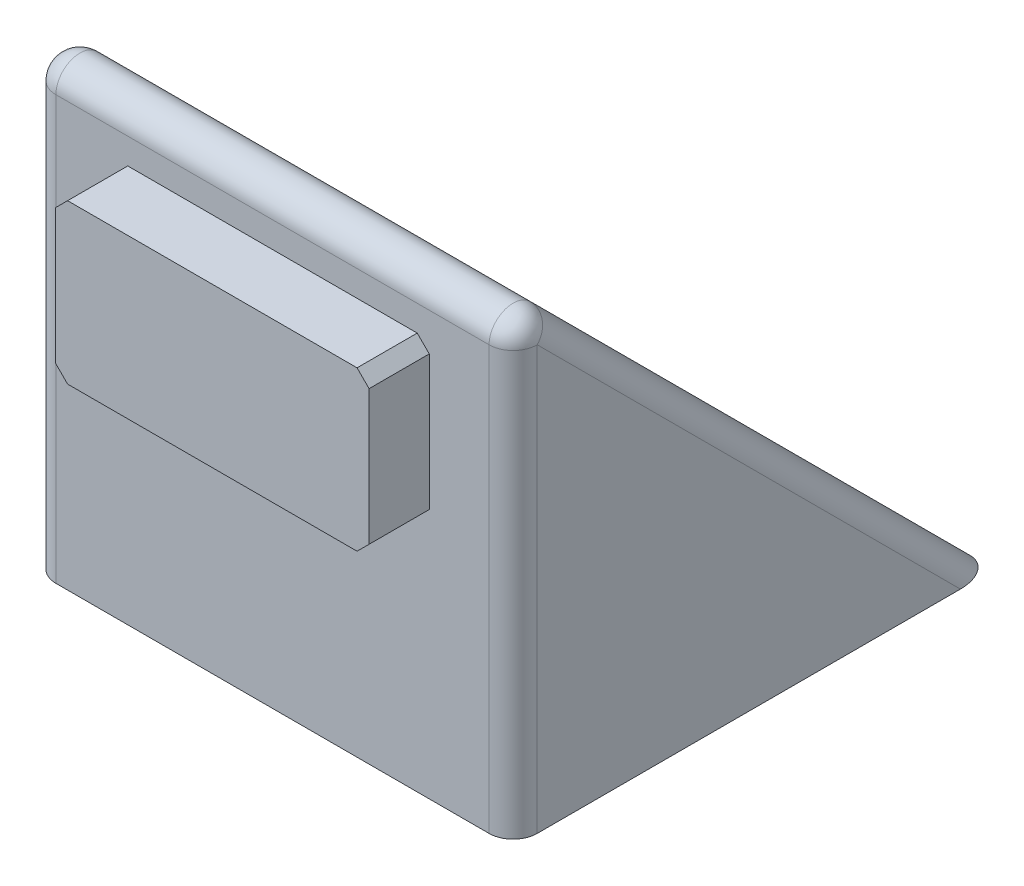
from build123d import *

# Parameters (mm, degrees)
Y_KSEKLIK_EKSTR_ZYON1_DEPTH      = 20
Y_KSEKLIK_EKSTR_ZYON1_DEPTH_BACK = 20
Y_KSEKLIK_EKSTR_ZYON2_DEPTH      = 5
RADYUS1_R                        = 2
RADYUS2_R                        = 2


with BuildPart() as part:
    # Çizim1 → Yükseklik-Ekstrüzyon1 (new, two sides: drawn at the far end of the back side and taken through both)
    with BuildSketch(Plane(origin=(0, 0, 0), x_dir=(0, 0, -1), z_dir=(1, 0, 0)).offset(-Y_KSEKLIK_EKSTR_ZYON1_DEPTH_BACK)):
        Polygon((0, 0), (40, 0), (0, 40), align=None)
    extrude(amount=Y_KSEKLIK_EKSTR_ZYON1_DEPTH + Y_KSEKLIK_EKSTR_ZYON1_DEPTH_BACK)

    # Çizim3 → Yükseklik-Ekstrüzyon2 (add)
    with BuildSketch(Plane.XY):
        Polygon((-13.028588348, 32.028588348), (-12.028588348, 33.028588348), (12.028588348, 33.028588348), (13.028588348, 32.028588348), (13.028588348, 20.827816013), (12.028588348, 19.827816013), (-12.028588348, 19.827816013), (-13.028588348, 20.827816013), align=None)
    extrude(amount=Y_KSEKLIK_EKSTR_ZYON2_DEPTH)

    # Radyus1
    radyus1_edges = [part.edges().sort_by_distance(p)[0] for p in [
        (20, 20, 0),
        (20, 20, -20),
        (-20, 20, -20),
        (-20, 20, 0),
    ]]
    fillet(radyus1_edges, radius=RADYUS1_R)

    # Radyus2
    # the kernel refuses this fillet: 2 mm, written as the material it takes off along each edge
    with BuildSketch(Plane(origin=(18, 35.171572875, -2), x_dir=(0, 0, 1), z_dir=(1, 0, 0))) as radyus2_piece_1_section:
        Polygon((0, 0), (RADYUS2_R, 0), (RADYUS2_R, -RADYUS2_R * 2.41421356237), (-RADYUS2_R * 0.707106781187, -RADYUS2_R * 0.707106781187), align=None)
    radyus2_piece_1 = extrude(amount=RADYUS2_R, mode=Mode.PRIVATE)
    radyus2_piece_1 = radyus2_piece_1 - Plane(origin=(18, 35.171572875, -2), x_dir=(0, -0.9238795325112866, -0.38268343236508967), z_dir=(1, 0, 0)) * Sphere(RADYUS2_R, mode=Mode.PRIVATE)
    add(radyus2_piece_1, mode=Mode.SUBTRACT)
    with BuildSketch(Plane(origin=(-18, 35.171572875, -2), x_dir=(0, 0, 1), z_dir=(-1, 0, 0))) as radyus2_piece_2_section:
        Polygon((0, 0), (RADYUS2_R, 0), (RADYUS2_R, RADYUS2_R * 2.41421356237), (-RADYUS2_R * 0.707106781187, RADYUS2_R * 0.707106781187), align=None)
    radyus2_piece_2 = extrude(amount=RADYUS2_R, mode=Mode.PRIVATE)
    radyus2_piece_2 = radyus2_piece_2 - Plane(origin=(-18, 35.171572875, -2), x_dir=(0, -0.9238795325112866, -0.38268343236508967), z_dir=(-1, 0, 0)) * Sphere(RADYUS2_R, mode=Mode.PRIVATE)
    add(radyus2_piece_2, mode=Mode.SUBTRACT)
    with BuildSketch(Plane(origin=(18, 40, 0), x_dir=(0, -1, 0), z_dir=(-1, 0, 0))) as radyus2_piece_3:
        with BuildLine():
            CenterArc((RADYUS2_R * 2.41421356237, -RADYUS2_R), RADYUS2_R, 90, 135)
            Line((RADYUS2_R * 1.70710678119, -RADYUS2_R * 1.70710678119), (0, 0))
            Line((0, 0), (RADYUS2_R * 2.41421356237, 0))
        make_face()
    extrude(amount=36, mode=Mode.SUBTRACT)


solid = part.part
